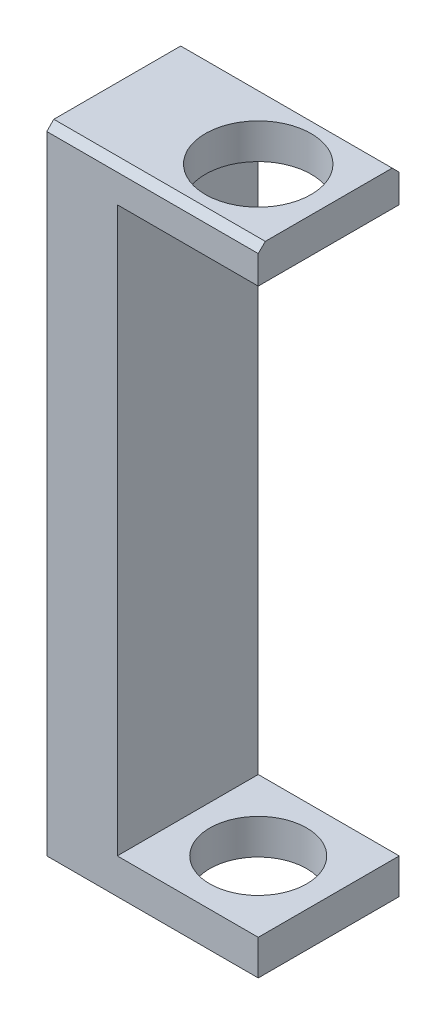
from build123d import *

# Parameters (mm, degrees)
SKETCH1_W                  = 76.2
SKETCH1_H                  = 50.8
BOSS_EXTRUDE1_DEPTH        = 228.6
SKETCH2_W                  = 50.8
SKETCH2_H                  = 203.2
CUT_EXTRUDE1_DEPTH         = 247.262136757
CUT_EXTRUDE2_REACH         = 248.262
SKETCH5_R                  = 19.05
CUT_EXTRUDE3_REACH         = 248.262
SKETCH8_R                  = 17.4625
F_10_32_TAPPED_HOLE1_D     = 4.0386
F_10_32_TAPPED_HOLE1_DEPTH = 42.0624
F_10_32_TAPPED_HOLE1_TIP   = 1.213317848
CHAMFER1_SIZE              = 2.54


with BuildPart() as part:
    # Sketch1 → Boss-Extrude1 (new body)
    with BuildSketch(Plane(origin=(0, 0, 0), x_dir=(1, 0, 0), z_dir=(0, 1, 0))):
        with Locations((38.1, 25.4)):
            Rectangle(SKETCH1_W, SKETCH1_H)
    extrude(amount=BOSS_EXTRUDE1_DEPTH)

    # Sketch2 → Cut-Extrude1 (cut, through all)
    with BuildSketch(Plane.XY):
        with Locations((50.8, 114.3)):
            Rectangle(SKETCH2_W, SKETCH2_H)
    extrude(amount=-CUT_EXTRUDE1_DEPTH, mode=Mode.SUBTRACT)

    # Sketch5 → Cut-Extrude2 (cut, up to next)
    with BuildSketch(Plane(origin=(0, 228.6, 0), x_dir=(1, 0, 0), z_dir=(0, 1, 0)), mode=Mode.PRIVATE) as cut_extrude2_sk1:
        with Locations((50.8, 25.4)):
            Circle(SKETCH5_R)
    cut_extrude2_tool1 = extrude(cut_extrude2_sk1.sketch, amount=-CUT_EXTRUDE2_REACH, mode=Mode.PRIVATE) & part.part
    add(cut_extrude2_tool1.solids().sort_by_distance((50.8, 228.6, -25.4))[0], mode=Mode.SUBTRACT)

    # Sketch8 → Cut-Extrude3 (cut, up to next)
    with BuildSketch(Plane.XZ, mode=Mode.PRIVATE) as cut_extrude3_sk1:
        with Locations((50.8, -25.4)):
            Circle(SKETCH8_R)
    cut_extrude3_tool1 = extrude(cut_extrude3_sk1.sketch, amount=-CUT_EXTRUDE3_REACH, mode=Mode.PRIVATE) & part.part
    add(cut_extrude3_tool1.solids().sort_by_distance((50.8, 0, -25.4))[0], mode=Mode.SUBTRACT)

    # #10-32 Tapped Hole1
    with Locations(Plane(origin=(0, 0, 0), x_dir=(-1, 0, 0), z_dir=(0, -1, 0))):
        with Locations((-6.35, 44.45), (-19.05, 44.45), (-6.35, 6.35), (-19.05, 6.35)):
            Hole(F_10_32_TAPPED_HOLE1_D / 2, depth=F_10_32_TAPPED_HOLE1_DEPTH)
            with Locations((0, 0, -(F_10_32_TAPPED_HOLE1_DEPTH + F_10_32_TAPPED_HOLE1_TIP / 2))):  # 118° drill point
                Cone(0, F_10_32_TAPPED_HOLE1_D / 2, F_10_32_TAPPED_HOLE1_TIP, mode=Mode.SUBTRACT)

    # Chamfer1
    chamfer1_edges = [part.edges().sort_by_distance(p)[0] for p in [
        (38.1, 228.6, -50.8),
        (38.1, 228.6, 0),
    ]]
    chamfer(chamfer1_edges, length=CHAMFER1_SIZE)


solid = part.part
